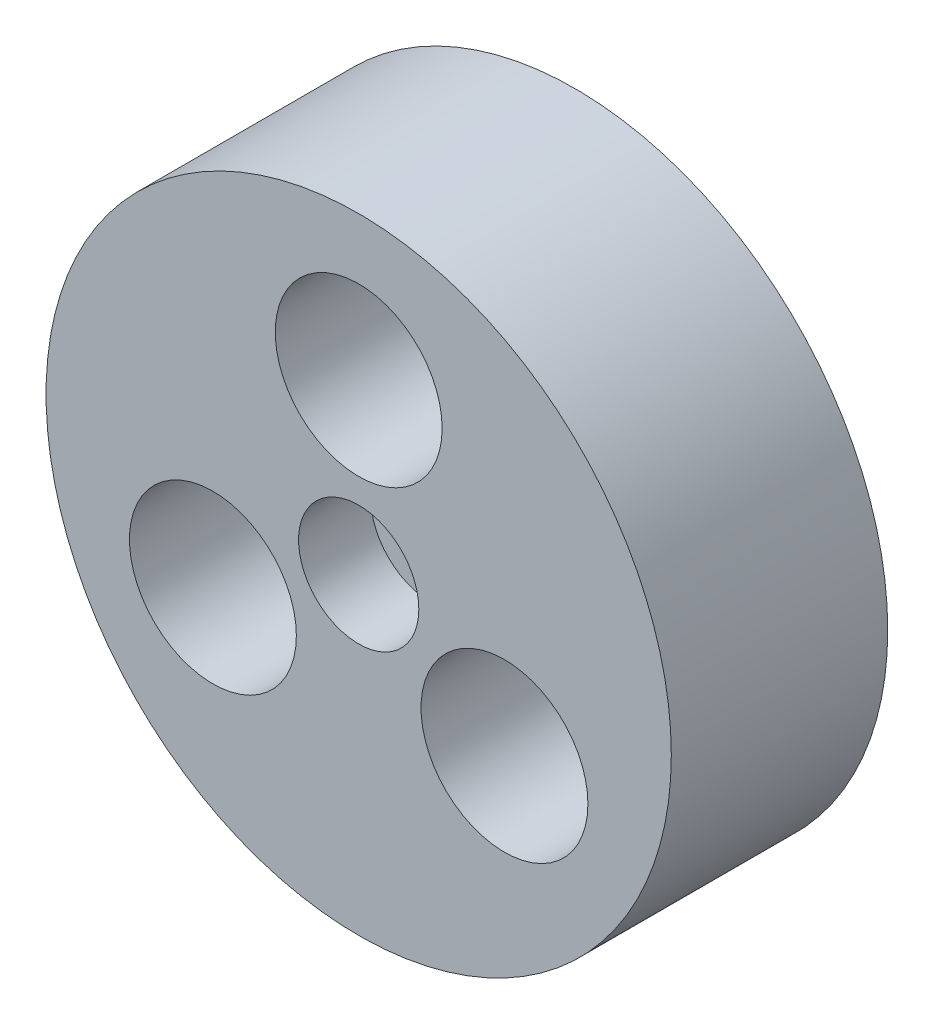
from build123d import *

# Parameters (mm, degrees)
SKETCH1_R                                            = 13
BOSS_EXTRUDE1_DEPTH                                  = 4
CSK_FOR_M3_HEX_SOCKET_COUNTERSUNK_HEAD_S_D           = 3.4
CSK_FOR_M3_HEX_SOCKET_COUNTERSUNK_HEAD_S_DEPTH       = 12
CSK_FOR_M3_HEX_SOCKET_COUNTERSUNK_HEAD_S_CSINK_D     = 6.94
CSK_FOR_M3_HEX_SOCKET_COUNTERSUNK_HEAD_S_CSINK_ANGLE = 90
CSK_FOR_M3_HEX_SOCKET_COUNTERSUNK_HEAD_S_TIP         = 1.021463052
SKETCH8_R                                            = 13
SKETCH8_R_2                                          = 3.47
BOSS_EXTRUDE2_DEPTH                                  = 5
SKETCH9_R                                            = 2.5
CUT_EXTRUDE1_DEPTH                                   = 3


with BuildPart() as part:
    # Sketch1 → Boss-Extrude1 (new body)
    with BuildSketch(Plane.XY):
        Circle(SKETCH1_R)
    extrude(amount=BOSS_EXTRUDE1_DEPTH)

    # CSK for M3 Hex Socket Countersunk Head Screw1
    with Locations(Plane.XY.offset(4)):
        with Locations((0, 7), (6.062177826, -3.5), (-6.062177826, -3.5)):
            CounterSinkHole(CSK_FOR_M3_HEX_SOCKET_COUNTERSUNK_HEAD_S_D / 2, CSK_FOR_M3_HEX_SOCKET_COUNTERSUNK_HEAD_S_CSINK_D / 2, depth=CSK_FOR_M3_HEX_SOCKET_COUNTERSUNK_HEAD_S_DEPTH, counter_sink_angle=CSK_FOR_M3_HEX_SOCKET_COUNTERSUNK_HEAD_S_CSINK_ANGLE)
            with Locations((0, 0, -(CSK_FOR_M3_HEX_SOCKET_COUNTERSUNK_HEAD_S_DEPTH + CSK_FOR_M3_HEX_SOCKET_COUNTERSUNK_HEAD_S_TIP / 2))):  # 118° drill point
                Cone(0, CSK_FOR_M3_HEX_SOCKET_COUNTERSUNK_HEAD_S_D / 2, CSK_FOR_M3_HEX_SOCKET_COUNTERSUNK_HEAD_S_TIP, mode=Mode.SUBTRACT)

    # Sketch8 → Boss-Extrude2 (add)
    with BuildSketch(Plane.XY.offset(4)):
        Circle(SKETCH8_R)
        with Locations((-6.062177826, -3.5)):
            Circle(SKETCH8_R_2, mode=Mode.SUBTRACT)
        with Locations((6.062177826, -3.5)):
            Circle(SKETCH8_R_2, mode=Mode.SUBTRACT)
        with Locations((0, 7)):
            Circle(SKETCH8_R_2, mode=Mode.SUBTRACT)
    extrude(amount=BOSS_EXTRUDE2_DEPTH)

    # Sketch9 → Cut-Extrude1 (cut)
    with BuildSketch(Plane.XY.offset(9)):
        Circle(SKETCH9_R)
    extrude(amount=-CUT_EXTRUDE1_DEPTH, mode=Mode.SUBTRACT)


solid = part.part
